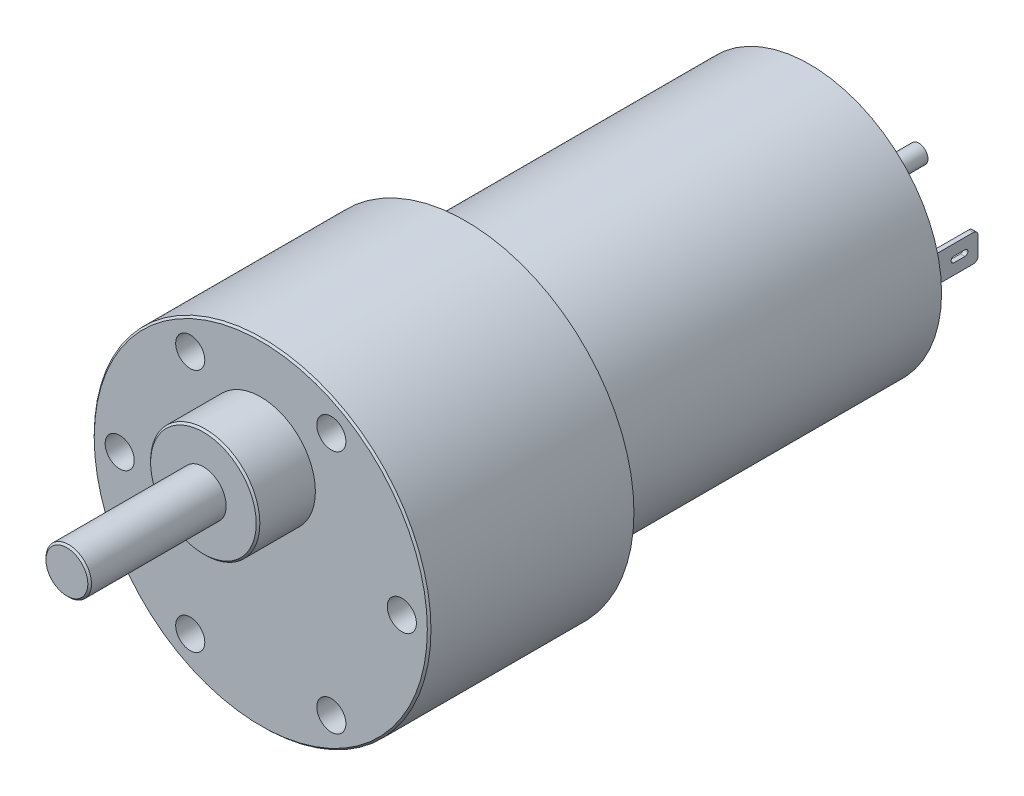
from build123d import *

# Parameters (mm, degrees)
SKETCH1_R           = 18.5
BOSS_EXTRUDE1_DEPTH = 22.5
SKETCH2_R           = 1.6
CUT_EXTRUDE1_DEPTH  = 3.5
SKETCH3_R           = 2.5
BOSS_EXTRUDE2_DEPTH = 21.3
SKETCH3_3_R         = 6
SKETCH3_3_R_2       = 2.5
BOSS_EXTRUDE3_DEPTH = 6.3
SKETCH4_R           = 14.5
BOSS_EXTRUDE4_DEPTH = 37.8
SKETCH5_R           = 5
BOSS_EXTRUDE5_DEPTH = 3
SKETCH6_R           = 1
BOSS_EXTRUDE6_DEPTH = 9
SKETCH7_W           = 0.5
SKETCH7_H           = 3
BOSS_EXTRUDE7_DEPTH = 6.5
CUT_EXTRUDE2_DEPTH  = 0.5
FILLET1_R           = 0.5
CHAMFER1_SIZE       = 0.2


with BuildPart() as part:
    # Sketch1 → Boss-Extrude1 (new body)
    with BuildSketch(Plane.XY):
        Circle(SKETCH1_R)
    extrude(amount=BOSS_EXTRUDE1_DEPTH)

    # Sketch2 → Cut-Extrude1 (cut)
    with BuildSketch(Plane.XY.offset(22.5)):
        with Locations((-7.75, 13.423393759)):
            Circle(SKETCH2_R)
        with Locations((7.75, 13.423393759)):
            Circle(SKETCH2_R)
        with Locations((-15.5, 0)):
            Circle(SKETCH2_R)
        with Locations((-7.75, -13.423393759)):
            Circle(SKETCH2_R)
        with Locations((7.75, -13.423393759)):
            Circle(SKETCH2_R)
        with Locations((15.5, 0)):
            Circle(SKETCH2_R)
    extrude(amount=-CUT_EXTRUDE1_DEPTH, mode=Mode.SUBTRACT)

    # Sketch3 → Boss-Extrude2 (add)
    with BuildSketch(Plane.XY.offset(22.5)):
        with Locations((0, 7)):
            Circle(SKETCH3_R)
    extrude(amount=BOSS_EXTRUDE2_DEPTH)

    # Sketch3<3> → Boss-Extrude3 (add)
    with BuildSketch(Plane.XY.offset(22.5)):
        with Locations((0, 7)):
            Circle(SKETCH3_3_R)
        with Locations((0, 7)):
            Circle(SKETCH3_3_R_2, mode=Mode.SUBTRACT)
    extrude(amount=BOSS_EXTRUDE3_DEPTH)

    # Sketch4 → Boss-Extrude4 (add)
    with BuildSketch(Plane(origin=(0, 0, 0), x_dir=(-1, 0, 0), z_dir=(0, 0, -1))):
        Circle(SKETCH4_R)
    extrude(amount=BOSS_EXTRUDE4_DEPTH)

    # Sketch5 → Boss-Extrude5 (add)
    with BuildSketch(Plane(origin=(0, 0, -37.8), x_dir=(-1, 0, 0), z_dir=(0, 0, -1))):
        Circle(SKETCH5_R)
    extrude(amount=BOSS_EXTRUDE5_DEPTH)

    # Sketch6 → Boss-Extrude6 (add)
    with BuildSketch(Plane(origin=(0, 0, -40.8), x_dir=(-1, 0, 0), z_dir=(0, 0, -1))):
        Circle(SKETCH6_R)
    extrude(amount=BOSS_EXTRUDE6_DEPTH)

    # Sketch7 → Boss-Extrude7 (add)
    with BuildSketch(Plane(origin=(0, 0, -37.8), x_dir=(-1, 0, 0), z_dir=(0, 0, -1))):
        with Locations((-11.75, 0)):
            Rectangle(SKETCH7_W, SKETCH7_H)
        with Locations((11.75, 0)):
            Rectangle(SKETCH7_W, SKETCH7_H)
    extrude(amount=BOSS_EXTRUDE7_DEPTH)

    # Sketch8 → Cut-Extrude2 (cut)
    with BuildSketch(Plane(origin=(12, 0, 0), x_dir=(0, 0, -1), z_dir=(1, 0, 0))):
        with BuildLine():
            Line((42.865122037, -0.320114275), (41.665122037, -0.320114275))
            ThreePointArc((41.665122037, -0.320114275), (41.345007763, 0), (41.665122037, 0.320114275))
            Line((41.665122037, 0.320114275), (42.865122037, 0.320114275))
            ThreePointArc((42.865122037, 0.320114275), (43.185236312, 0), (42.865122037, -0.320114275))
        make_face()
    cut_extrude2 = extrude(amount=-CUT_EXTRUDE2_DEPTH, mode=Mode.SUBTRACT)

    # Mirror2: Cut-Extrude2 across plane
    add(cut_extrude2.mirror(Plane(origin=(0, 0, 0), x_dir=(0, 0, 1), z_dir=(1, 0, 0))), mode=Mode.SUBTRACT)

    # Fillet1
    fillet1_edges = [part.edges().sort_by_distance(p)[0] for p in [
        (-11.75, 1.5, -44.3),
        (-11.75, -1.5, -44.3),
        (11.75, 1.5, -44.3),
        (11.75, -1.5, -44.3),
    ]]
    fillet(fillet1_edges, radius=FILLET1_R)

    # Chamfer1
    chamfer1_edges = [part.edges().sort_by_distance(p)[0] for p in [
        (-18.5, 0, 22.5),
        (-6, 7, 28.8),
        (-2.5, 7, 43.8),
    ]]
    chamfer(chamfer1_edges, length=CHAMFER1_SIZE)


solid = part.part
